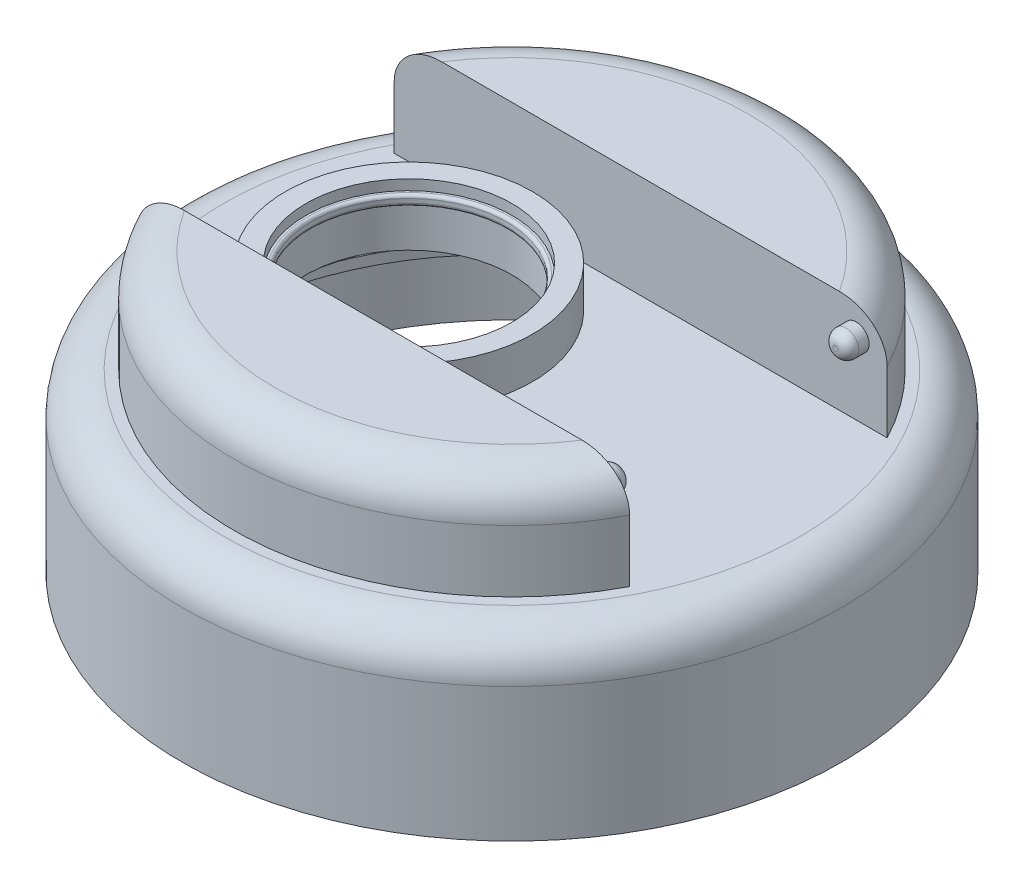
from build123d import *

# Parameters (mm, degrees)
SKETCH3_W           = 25
SKETCH3_H           = 12.38281708
CUT_EXTRUDE1_DEPTH  = 40.5
SKETCH4_R           = 1.25
BOSS_EXTRUDE1_DEPTH = 2
FILLET2_R           = 1
BOSS_EXTRUDE2_START = 2
SKETCH5_R           = 1.25
BOSS_EXTRUDE2_DEPTH = 2
FILLET3_R           = 1
SKETCH6_R           = 12
BOSS_EXTRUDE4_DEPTH = 4
SKETCH7_R           = 10
CUT_EXTRUDE2_DEPTH  = 6
SKETCH8_R           = 10
SKETCH8_R_2         = 9.5
BOSS_EXTRUDE5_DEPTH = 1
FILLET4_R           = 0.3
SWEEP1_PITCH        = 5
FILLET5_START       = -0.708009348
FILLET5_DEPTH       = 2.708009348
FILLET5_START_2     = -9
FILLET5_2_DEPTH     = 2.791990752


with BuildPart() as part:
    # Sketch1 → Revolve6 (revolve)
    with BuildSketch(Plane(origin=(0, 0, 0), x_dir=(0, 0, -1), z_dir=(1, 0, 0)), mode=Mode.PRIVATE) as revolve6_sk:
        with BuildLine():
            Line((-30, -10.208009248), (-30, 2.791990752))
            ThreePointArc((-30, 2.791990752), (-29.414213562, 4.206204315), (-28, 4.791990752))
            Line((-28, 4.791990752), (-26, 4.791990752))
            Line((-26, 4.791990752), (-26, 0.791990752))
            Line((-26, 0.791990752), (-24.5, 0.791990752))
            Line((-24.5, 0.791990752), (-24.5, 4.791990752))
            Line((-24.5, 4.791990752), (0, 4.791990752))
            Line((0, 4.791990752), (0, 16.791990752))
            Line((0, 16.791990752), (-23, 16.791990752))
            ThreePointArc((-23, 16.791990752), (-25.828427125, 15.620417877), (-27, 12.791990752))
            Line((-27, 12.791990752), (-27, 6.791990752))
            Line((-27, 6.791990752), (-28, 6.791990752))
            ThreePointArc((-28, 6.791990752), (-30.828427125, 5.620417877), (-32, 2.791990752))
            Line((-32, 2.791990752), (-32, -10.208009248))
            Line((-32, -10.208009248), (-30, -10.208009248))
        make_face()
    revolve(revolve6_sk.sketch.rotate(Axis((0, 4.791990752, 0), (0, 1, 0)), 180), axis=Axis((0, 4.791990752, 0), (0, 1, 0)))

    # Sketch3 → Cut-Extrude1 (cut, symmetric)
    with BuildSketch(Plane(origin=(0, 0, 0), x_dir=(0, 0, -1), z_dir=(1, 0, 0))):
        with Locations((0, 12.983399292)):
            Rectangle(SKETCH3_W, SKETCH3_H)
    extrude(amount=CUT_EXTRUDE1_DEPTH, both=True, mode=Mode.SUBTRACT)

    # Sketch4 → Boss-Extrude1 (add)
    with BuildSketch(Plane.XY.offset(-12.5)):
        with Locations(Location((20.932195888, 13.791990752, 0), (0, 0, 90))):
            Circle(SKETCH4_R)
    extrude(amount=BOSS_EXTRUDE1_DEPTH)

    # Fillet2
    fillet2_edges = [part.edges().sort_by_distance(p)[0] for p in [
        (20.932195888, 12.541990752, -10.5),
    ]]
    fillet(fillet2_edges, radius=FILLET2_R)

    # Sketch5 → Boss-Extrude2 (add)
    with BuildSketch(Plane(origin=(0, 0, 12.5), x_dir=(-1, 0, 0), z_dir=(0, 0, -1)).offset(BOSS_EXTRUDE2_START)):
        with Locations(Location((-20.932195888, 13.791990752, 0), (0, 0, 90))):
            Circle(SKETCH5_R)
    extrude(amount=-BOSS_EXTRUDE2_DEPTH)

    # Fillet3
    fillet3_edges = [part.edges().sort_by_distance(p)[0] for p in [
        (20.932195888, 12.541990752, 10.5),
    ]]
    fillet(fillet3_edges, radius=FILLET3_R)

    # Sketch6 → Boss-Extrude4 (add)
    with BuildSketch(Plane(origin=(0, 6.791990752, 0), x_dir=(1, 0, 0), z_dir=(0, 1, 0))):
        with Locations(Location((-10, 0, 0), (0, 0, 90))):
            Circle(SKETCH6_R)
    extrude(amount=BOSS_EXTRUDE4_DEPTH)

    # Sketch7 → Cut-Extrude2 (cut)
    with BuildSketch(Plane(origin=(0, 10.791990752, 0), x_dir=(1, 0, 0), z_dir=(0, 1, 0))):
        with Locations(Location((-10, 0, 0), (0, 0, 270))):
            Circle(SKETCH7_R)
    extrude(amount=-CUT_EXTRUDE2_DEPTH, mode=Mode.SUBTRACT)

    # Sketch8 → Boss-Extrude5 (add)
    with BuildSketch(Plane(origin=(0, 9.791990752, 0), x_dir=(1, 0, 0), z_dir=(0, 1, 0))):
        with Locations(Location((-10, 0, 0), (0, 0, 270))):
            Circle(SKETCH8_R)
        with Locations(Location((-10, 0, 0), (0, 0, 270))):
            Circle(SKETCH8_R_2, mode=Mode.SUBTRACT)
    extrude(amount=-BOSS_EXTRUDE5_DEPTH)

    # Fillet4
    fillet4_edges = [part.edges().sort_by_distance(p)[0] for p in [
        (-10, 8.791990752, -9.5),
        (-10, 9.791990752, -9.5),
    ]]
    fillet(fillet4_edges, radius=FILLET4_R)

    # Sweep1: arcs per turn and ends read off the stored shape
    # Sweep1: the profile of Sketch10 profile screwed along a right-hand helix through 1.5 turns, 12 arcs to a turn; built about Z, then put on its axis
    sweep1_z = Axis((0, 0, 0), (0, 0, 1))
    sweep1_corners = [(30.0003, 0, -1.000075), (30.0003, 0, 1.000075), (28, 0, 0.5), (28, 0, -0.5)]
    with BuildLine(mode=Mode.PRIVATE) as sweep1_profile:
        Line(sweep1_corners[0], sweep1_corners[1])
        Line(sweep1_corners[1], sweep1_corners[2])
        Line(sweep1_corners[2], sweep1_corners[3])
        Line(sweep1_corners[3], sweep1_corners[0])
    sweep1_cap = Face(sweep1_profile.wire())
    sweep1_turn_angles = [0, 15, 30, 45, 60, 75, 90, 105, 120, 135, 150, 165, 180, 195, 210, 225, 240, 255, 270, 285, 300, 315, 330, 345, 360]
    sweep1_turn_weights = [1, 0.9659258262890683, 1, 0.9659258262890683, 1, 0.9659258262890683, 1, 0.9659258262890683, 1, 0.9659258262890683, 1, 0.9659258262890683, 1, 0.9659258262890683, 1, 0.9659258262890683, 1, 0.9659258262890683, 1, 0.9659258262890683, 1, 0.9659258262890683, 1, 0.9659258262890683, 1]
    sweep1_turn_rails = [Edge.make_bspline([Vector(p[0], p[1], 0).rotate(sweep1_z, sweep1_turn_angles[k]) / sweep1_turn_weights[k] + Vector(0, 0, p[2] + SWEEP1_PITCH * sweep1_turn_angles[k] / 360) for k in range(25)], [0, 0, 0, 1, 1, 2, 2, 3, 3, 4, 4, 5, 5, 6, 6, 7, 7, 8, 8, 9, 9, 10, 10, 11, 11, 12, 12, 12], 2, sweep1_turn_weights) for p in sweep1_corners]
    sweep1_turn_sides = [Face.make_surface_from_curves(sweep1_turn_rails[p[0]], sweep1_turn_rails[p[1]]) for p in [(0, 1), (1, 2), (2, 3), (3, 0)]]
    sweep1_last_angles = [360, 375, 390, 405, 420, 435, 450, 465, 480, 495, 510, 525, 540]
    sweep1_last_weights = [1, 0.9659258262890683, 1, 0.9659258262890683, 1, 0.9659258262890683, 1, 0.9659258262890683, 1, 0.9659258262890683, 1, 0.9659258262890662, 1]
    sweep1_last_rails = [Edge.make_bspline([Vector(p[0], p[1], 0).rotate(sweep1_z, sweep1_last_angles[k]) / sweep1_last_weights[k] + Vector(0, 0, p[2] + SWEEP1_PITCH * sweep1_last_angles[k] / 360) for k in range(13)], [0, 0, 0, 1, 1, 2, 2, 3, 3, 4, 4, 5, 5, 6, 6, 6], 2, sweep1_last_weights) for p in sweep1_corners]
    sweep1_last_sides = [Face.make_surface_from_curves(sweep1_last_rails[p[0]], sweep1_last_rails[p[1]]) for p in [(0, 1), (1, 2), (2, 3), (3, 0)]]
    sweep1 = Plane(origin=(0, -7.208009248, 0), x_dir=(-1, 0, 0), z_dir=(0, 1, 0)) * Solid(Shell([*sweep1_turn_sides, *sweep1_last_sides, sweep1_cap, sweep1_cap.rotate(sweep1_z, 540).moved(Location((0, 0, SWEEP1_PITCH * 540 / 360)))]))
    add(sweep1)

    # Fillet5: read off the stored shape, not the designer's step
    # Fillet5 outline → Fillet5 (cut)
    with BuildSketch(Plane(origin=(0, 0, 0), x_dir=(1, 0, 0), z_dir=(0, 1, 0)).offset(FILLET5_START)):
        with BuildLine():
            add(Edge.make_bspline(
                [(27.557894737, -4.956050612), (28, -2.49774434), (28, 0)],
                knots=[0.235805771, 0.235805771, 0.235805771, 0.25, 0.25, 0.25], degree=2, weights=[0.984693115, 0.988392241, 1]))
            add(Edge.make_bspline(
                [(27.557894737, -4.956050612), (28.066666667, -2.127047363), (30, 0)],
                knots=[0, 0, 0, 1, 1, 1], degree=2, weights=[1, 0.961084913, 1]))
            Line((30, 0), (28, 0))
        make_face()
    extrude(amount=FILLET5_DEPTH, mode=Mode.SUBTRACT)

    # Fillet5 2 outline → Fillet5 2 (cut)
    with BuildSketch(Plane(origin=(0, 0, 0), x_dir=(1, 0, 0), z_dir=(0, 1, 0)).offset(FILLET5_START_2)):
        with BuildLine():
            add(Edge.make_bspline(
                [(-27.557894737, -4.956050612), (-28.066666667, -2.127047363), (-30, 0)],
                knots=[0, 0, 0, 1, 1, 1], degree=2, weights=[1, 0.961084913, 1]))
            add(Edge.make_bspline(
                [(-28, 0), (-28, -2.49774434), (-27.557894737, -4.956050612)],
                knots=[0, 0, 0, 0.014194229, 0.014194229, 0.014194229], degree=2, weights=[1, 0.988392241, 0.984693115]))
            Line((-28, 0), (-30, 0))
        make_face()
    extrude(amount=FILLET5_2_DEPTH, mode=Mode.SUBTRACT)


solid = part.part
